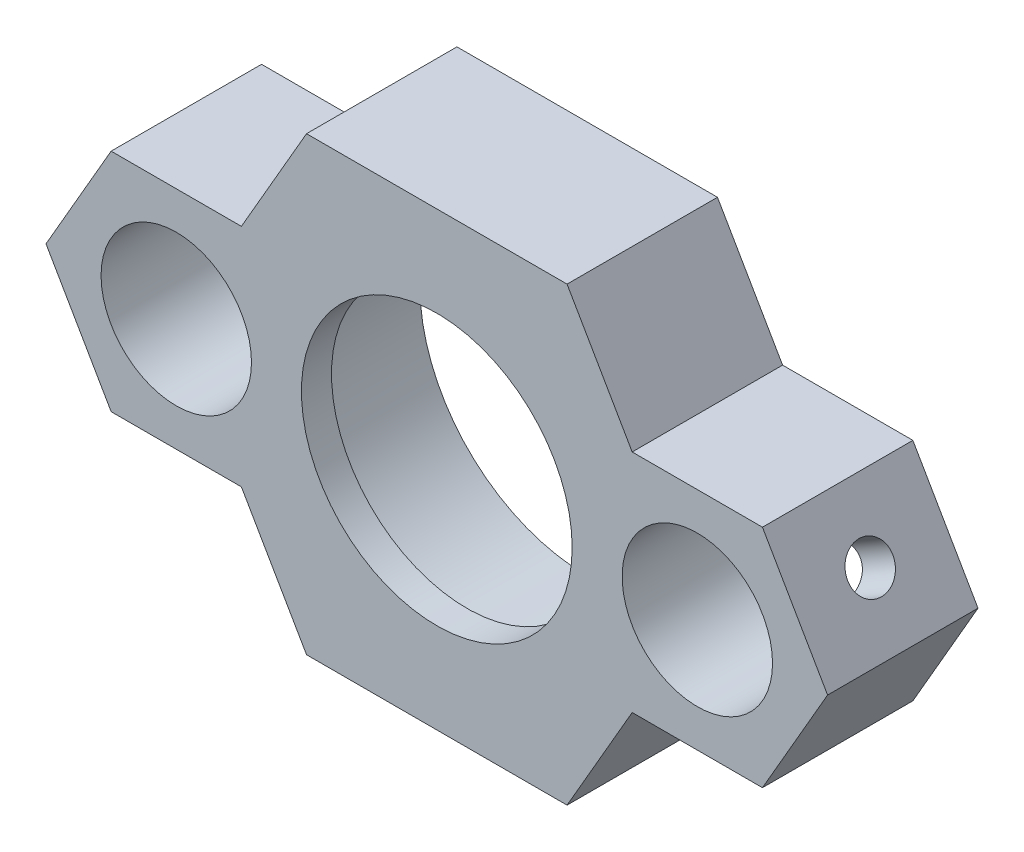
from build123d import *

# Parameters (mm, degrees)
SKETCH3_R               = 11.125
SKETCH3_R_2             = 5
BOSS_EXTRUDE1_DEPTH     = 8
SKETCH4_R               = 9
SKETCH4_R_2             = 5
BOSS_EXTRUDE3_DEPTH     = 2
CUT_EXTRUDE1_REACH      = 55.444
CUT_EXTRUDE1_END_RADIUS = 5
SKETCH5_R               = 1.5
CUT_EXTRUDE2_REACH      = 55.444
CUT_EXTRUDE2_END_RADIUS = 5
SKETCH6_R               = 1.5


with BuildPart() as part:
    # Sketch3 → Boss-Extrude1 (new body)
    with BuildSketch(Plane.XY):
        Polygon((8.660254038, 15), (-8.660254038, 15), (-12.990381057, 7.5), (-21.650635095, 7.5), (-25.980762114, 0), (-21.650635095, -7.5), (-12.990381057, -7.5), (-8.660254038, -15), (8.660254038, -15), (12.990381057, -7.5), (21.650635095, -7.5), (25.980762114, 0), (21.650635095, 7.5), (12.990381057, 7.5), align=None)
        Circle(SKETCH3_R, mode=Mode.SUBTRACT)
        with Locations((17.320508076, 0)):
            Circle(SKETCH3_R_2, mode=Mode.SUBTRACT)
        with Locations((-17.320508076, 0)):
            Circle(SKETCH3_R_2, mode=Mode.SUBTRACT)
    extrude(amount=BOSS_EXTRUDE1_DEPTH)

    # Sketch4 → Boss-Extrude3 (add)
    with BuildSketch(Plane.XY.offset(8)):
        Polygon((-8.660254038, 15), (-12.990381057, 7.5), (-21.650635095, 7.5), (-25.980762114, 0), (-21.650635095, -7.5), (-12.990381057, -7.5), (-8.660254038, -15), (8.660254038, -15), (12.990381057, -7.5), (21.650635095, -7.5), (25.980762114, 0), (21.650635095, 7.5), (12.990381057, 7.5), (8.660254038, 15), align=None)
        Circle(SKETCH4_R, mode=Mode.SUBTRACT)
        with Locations((-17.320508076, 0)):
            Circle(SKETCH4_R_2, mode=Mode.SUBTRACT)
        with Locations((17.320508076, 0)):
            Circle(SKETCH4_R_2, mode=Mode.SUBTRACT)
    extrude(amount=BOSS_EXTRUDE3_DEPTH)

    # Cut-Extrude1: up to this cylinder (the profile starts outside it)
    cut_extrude1_end = Plane(origin=(-17.320508076, 0, 5), z_dir=(0, 0, -1)) * Cylinder(CUT_EXTRUDE1_END_RADIUS, 121.888, mode=Mode.PRIVATE)
    # Sketch5 → Cut-Extrude1 (cut, up to the surface)
    with BuildSketch(Plane(origin=(-19.485571585, 11.25, 0), x_dir=(0, 0, 1), z_dir=(-0.866025403784439, 0.49999999999999944, 0)), mode=Mode.PRIVATE) as cut_extrude1_sk1:
        with Locations((5, -8.660254038)):
            Circle(SKETCH5_R)
    cut_extrude1_tool1 = extrude(cut_extrude1_sk1.sketch, amount=-CUT_EXTRUDE1_REACH, mode=Mode.PRIVATE) - cut_extrude1_end
    add(cut_extrude1_tool1.solids().sort_by_distance((-23.815699, 3.75, 5))[0], mode=Mode.SUBTRACT)

    # Cut-Extrude2: up to this cylinder (the profile starts outside it)
    cut_extrude2_end = Plane(origin=(17.320508076, 0, 5), z_dir=(0, 0, -1)) * Cylinder(CUT_EXTRUDE2_END_RADIUS, 121.888, mode=Mode.PRIVATE)
    # Sketch6 → Cut-Extrude2 (cut, up to the surface)
    with BuildSketch(Plane(origin=(19.485571585, 11.25, 0), x_dir=(0, 0, -1), z_dir=(0.866025403784439, 0.4999999999999993, 0)), mode=Mode.PRIVATE) as cut_extrude2_sk1:
        with Locations((-5, -8.660254038)):
            Circle(SKETCH6_R)
    cut_extrude2_tool1 = extrude(cut_extrude2_sk1.sketch, amount=-CUT_EXTRUDE2_REACH, mode=Mode.PRIVATE) - cut_extrude2_end
    add(cut_extrude2_tool1.solids().sort_by_distance((23.815699, 3.75, 5))[0], mode=Mode.SUBTRACT)


solid = part.part
